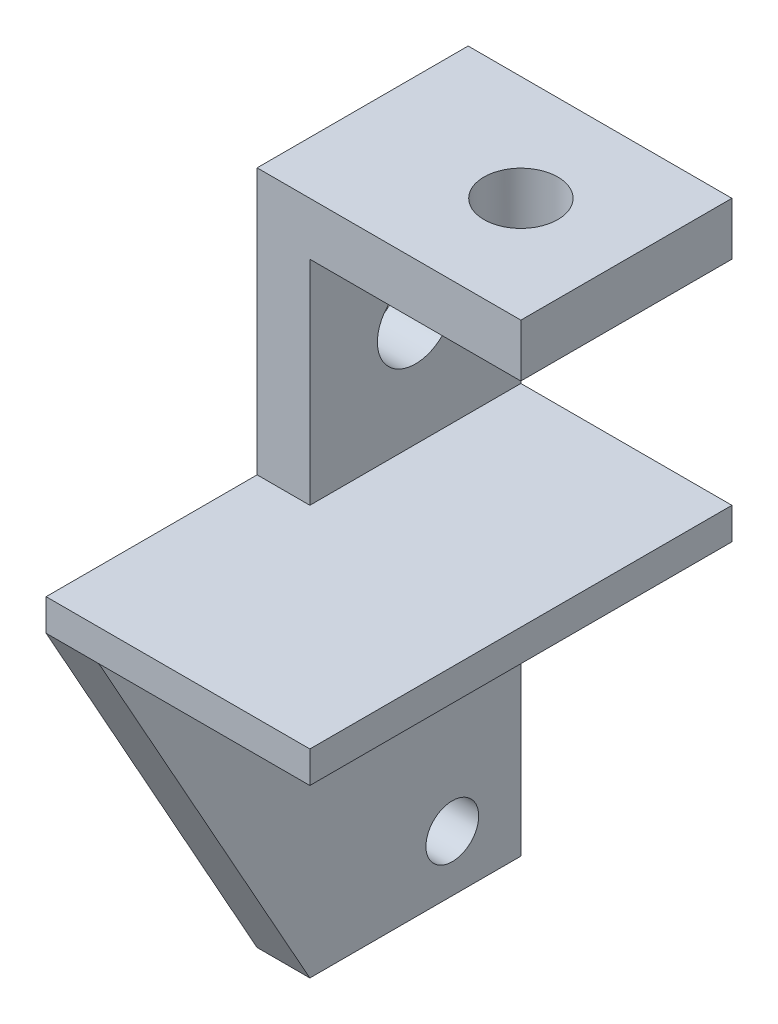
from build123d import *

# Parameters (mm, degrees)
BOSS_EXTRUDE1_DEPTH      = 10
SKETCH2_R                = 1.75
CUT_EXTRUDE1_DEPTH       = 10
SKETCH3_R                = 1.25
SKETCH3_R_2              = 1.8
CUT_EXTRUDE2_DEPTH       = 40.143965052
SKETCH4_W                = 13.022509218
SKETCH4_H                = 4.5
CUT_EXTRUDE3_DEPTH       = 40.143965052
BOSS_EXTRUDE2_DEPTH      = 10
BOSS_EXTRUDE2_DEPTH_BACK = 10
SKETCH5_W                = 12.5
SKETCH5_H                = 1.5
LOFT2_DEPTH              = 2.5


# Read off the part's stored shape, not the designer's step: Loft2
with BuildPart() as part:
    # Sketch1 → Boss-Extrude1 (new body)
    with BuildSketch(Plane.XY):
        Polygon((0, 0), (0, 36.5), (12.5, 36.5), (12.5, 34), (2.5, 34), (2.5, 0), align=None)
    extrude(amount=BOSS_EXTRUDE1_DEPTH)

    # Sketch2 → Cut-Extrude1 (cut)
    with BuildSketch(Plane.XZ.offset(-34)):
        with Locations((7.5, 5)):
            Circle(SKETCH2_R)
    extrude(amount=-CUT_EXTRUDE1_DEPTH, mode=Mode.SUBTRACT)

    # Sketch3 → Cut-Extrude2 (cut, through all)
    with BuildSketch(Plane(origin=(2.5, 0, 0), x_dir=(0, 0, -1), z_dir=(1, 0, 0))):
        with Locations(Location((-3.25, 7.15, 0), (0, 0, 90))):
            Circle(SKETCH3_R)
        with Locations(Location((-3.25, 16.85, 0), (0, 0, 270))):
            Circle(SKETCH3_R)
        with Locations(Location((-5, 29, 0), (0, 0, 90))):
            Circle(SKETCH3_R_2)
    extrude(amount=-CUT_EXTRUDE2_DEPTH, mode=Mode.SUBTRACT)

    # Sketch4 → Cut-Extrude3 (cut, through all)
    with BuildSketch(Plane(origin=(2.5, 0, 0), x_dir=(0, 0, -1), z_dir=(1, 0, 0))):
        with Locations((-6.511254609, 2.25)):
            Rectangle(SKETCH4_W, SKETCH4_H)
    extrude(amount=-CUT_EXTRUDE3_DEPTH, mode=Mode.SUBTRACT)

    # Sketch5 → Boss-Extrude2 (add, two sides: drawn at the far end of the back side and taken through both)
    with BuildSketch(Plane.XY.offset(10).offset(-BOSS_EXTRUDE2_DEPTH_BACK)):
        with Locations((6.25, 23.15)):
            Rectangle(SKETCH5_W, SKETCH5_H)
    extrude(amount=BOSS_EXTRUDE2_DEPTH + BOSS_EXTRUDE2_DEPTH_BACK)

    # Loft2 outline → Loft2 (add)
    with BuildSketch(Plane.YZ):
        Polygon((22.4, 10), (22.4, 20), (4.5, 10), align=None)
    extrude(amount=LOFT2_DEPTH)


solid = part.part
